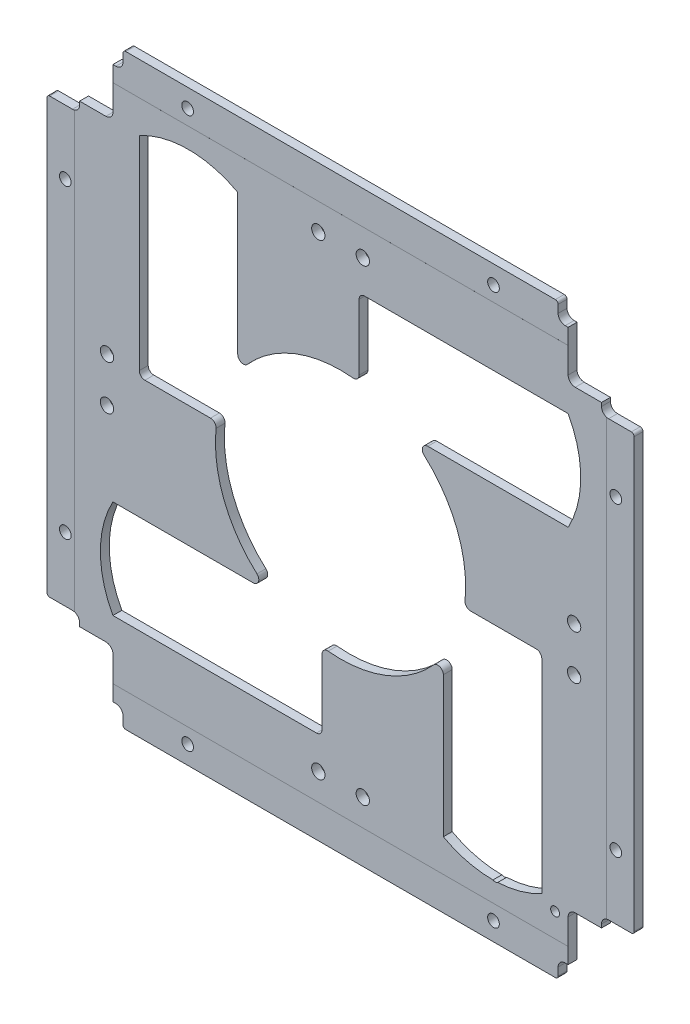
from build123d import *

# Parameters (mm, degrees)
SKETCH1_W                           = 106
SKETCH1_H                           = 106
MAINOUTLINE_DEPTH                   = 1.6
SKETCH4_W                           = 11.7
SKETCH4_H                           = 11.7
RAILCUTOUTS_DEPTH                   = 75.970394157
SKETCH13_W                          = 5.7
SKETCH13_H                          = 1.9
SKETCH13_W_2                        = 1.8
SKETCH13_H_2                        = 3
FILLETCUTOUTS_DEPTH                 = 75.970394157
SMOOTHCORNER_DEPTH                  = 10
MIRROR2_COPY_1_SKETCH_W             = 11.7
MIRROR2_COPY_1_SKETCH_H             = 11.7
MIRROR2_COPY_1_DEPTH                = 75.970394157
MIRROR2_COPY_2_SKETCH_W             = 5.7
MIRROR2_COPY_2_SKETCH_H             = 1.9
MIRROR2_COPY_2_SKETCH_W_2           = 1.8
MIRROR2_COPY_2_SKETCH_H_2           = 3
MIRROR2_COPY_2_DEPTH                = 75.970394157
MIRROR2_COPY_3_DEPTH                = 10
MIRROR2_COPY_4_SKETCH_W             = 11.7
MIRROR2_COPY_4_SKETCH_H             = 11.7
MIRROR2_COPY_4_DEPTH                = 75.970394157
MIRROR2_COPY_5_SKETCH_W             = 5.7
MIRROR2_COPY_5_SKETCH_H             = 1.9
MIRROR2_COPY_5_SKETCH_W_2           = 1.8
MIRROR2_COPY_5_SKETCH_H_2           = 3
MIRROR2_COPY_5_DEPTH                = 75.970394157
MIRROR2_COPY_6_DEPTH                = 10
M2_CLEARANCE_HOLE1_D                = 2.1
INTERBOARDCONNECTORHOLES_DEPTH      = 75.970394157
INTERBOARDCONNECTORHOLES_DEPTH_BACK = 75.970394157
SKETCH12_R                          = 0.8
SKETCH16_W                          = 90
SKETCH16_H                          = 6.2
SKETCH16_W_2                        = 5.2
SKETCH16_H_2                        = 90
CUT_EXTRUDE6_DEPTH                  = 0.001
CUT_EXTRUDE10_DEPTH                 = 75.970394157
CUT_EXTRUDE10_DEPTH_BACK            = 75.970394157
SKETCH21_R                          = 22.5
F_2U_TURNSTILE_CUTOUT_REACH         = 76.97
SKETCH24_OUTSIDE_W                  = 137.984
SKETCH24_OUTSIDE_H                  = 137.984
SKETCH24_OUTSIDE_W_2                = 105.6
SKETCH24_OUTSIDE_H_2                = 105.6
CUT_EXTRUDE19_DEPTH                 = 75.970394157
FILLET7_R                           = 0.5
FILLET8_R                           = 1
M2_CLEARANCE_HOLE2_D                = 2.4


with BuildPart() as part:
    # Sketch1 → mainOutline (new body)
    with BuildSketch(Plane.XY):
        Rectangle(SKETCH1_W, SKETCH1_H)
    extrude(amount=MAINOUTLINE_DEPTH)

    # Sketch4 → railCutouts (cut, through all)
    with BuildSketch(Plane(origin=(0, 0, 0), x_dir=(-1, 0, 0), z_dir=(0, 0, -1))):
        with Locations((47.15, 47.15)):
            Rectangle(SKETCH4_W, SKETCH4_H)
    railcutouts = extrude(amount=-RAILCUTOUTS_DEPTH, mode=Mode.SUBTRACT)

    # Sketch13 → filletCutouts (cut, symmetric)
    with BuildSketch(Plane(origin=(0, 0, 0), x_dir=(-1, 0, 0), z_dir=(0, 0, -1))):
        with Locations((50.15, 40.35)):
            Rectangle(SKETCH13_W, SKETCH13_H)
        with Locations((40.4, 51.5)):
            Rectangle(SKETCH13_W_2, SKETCH13_H_2)
    filletcutouts = extrude(amount=FILLETCUTOUTS_DEPTH, both=True, mode=Mode.SUBTRACT)

    # Sketch27 → smoothCorner (cut)
    with BuildSketch(Plane.XY.offset(1.6)):
        with BuildLine():
            Line((-40.928025612, 42.198025612), (-40.928025612, 49.628025612))
            Line((-40.928025612, 49.628025612), (-40.398025612, 49.628025612))
            ThreePointArc((-40.398025612, 49.628025612), (-39.5, 50), (-39.128025612, 50.898025612))
            Line((-39.128025612, 50.898025612), (-39.128025612, 53))
            Line((-39.128025612, 53), (-53, 53))
            Line((-53, 53), (-53, 39.028025612))
            Line((-53, 39.028025612), (-48.198025612, 39.028025612))
            ThreePointArc((-48.198025612, 39.028025612), (-47.3, 39.4), (-46.928025612, 40.298025612))
            Line((-46.928025612, 40.298025612), (-46.928025612, 40.928025612))
            Line((-46.928025612, 40.928025612), (-42.198025612, 40.928025612))
            ThreePointArc((-42.198025612, 40.928025612), (-41.3, 41.3), (-40.928025612, 42.198025612))
        make_face()
    smoothcorner = extrude(amount=-SMOOTHCORNER_DEPTH, mode=Mode.SUBTRACT)

    # Mirror1: railCutouts, filletCutouts, smoothCorner across plane
    add(railcutouts.mirror(Plane(origin=(0, 0, 0), x_dir=(0, 0, 1), z_dir=(1, 0, 0))), mode=Mode.SUBTRACT)
    add(filletcutouts.mirror(Plane(origin=(0, 0, 0), x_dir=(0, 0, 1), z_dir=(1, 0, 0))), mode=Mode.SUBTRACT)
    add(smoothcorner.mirror(Plane(origin=(0, 0, 0), x_dir=(0, 0, 1), z_dir=(1, 0, 0))), mode=Mode.SUBTRACT)

    # Mirror2 copy 1 sketch → Mirror2 copy 1 (cut, through all)
    with BuildSketch(Plane(origin=(0, 0, 0), x_dir=(1, 0, 0), z_dir=(0, 0, -1))):
        with Locations((47.15, 47.15)):
            Rectangle(MIRROR2_COPY_1_SKETCH_W, MIRROR2_COPY_1_SKETCH_H)
    extrude(amount=-MIRROR2_COPY_1_DEPTH, mode=Mode.SUBTRACT)

    # Mirror2 copy 2 sketch → Mirror2 copy 2 (cut, symmetric)
    with BuildSketch(Plane(origin=(0, 0, 0), x_dir=(1, 0, 0), z_dir=(0, 0, -1))):
        with Locations((50.15, 40.35)):
            Rectangle(MIRROR2_COPY_2_SKETCH_W, MIRROR2_COPY_2_SKETCH_H)
        with Locations((40.4, 51.5)):
            Rectangle(MIRROR2_COPY_2_SKETCH_W_2, MIRROR2_COPY_2_SKETCH_H_2)
    extrude(amount=MIRROR2_COPY_2_DEPTH, both=True, mode=Mode.SUBTRACT)

    # Mirror2 copy 3 sketch → Mirror2 copy 3 (cut)
    with BuildSketch(Plane(origin=(0, 0, 1.6), x_dir=(-1, 0, 0), z_dir=(0, 0, 1))):
        with BuildLine():
            Line((-40.928025612, 42.198025612), (-40.928025612, 49.628025612))
            Line((-40.928025612, 49.628025612), (-40.398025612, 49.628025612))
            ThreePointArc((-40.398025612, 49.628025612), (-39.5, 50), (-39.128025612, 50.898025612))
            Line((-39.128025612, 50.898025612), (-39.128025612, 53))
            Line((-39.128025612, 53), (-53, 53))
            Line((-53, 53), (-53, 39.028025612))
            Line((-53, 39.028025612), (-48.198025612, 39.028025612))
            ThreePointArc((-48.198025612, 39.028025612), (-47.3, 39.4), (-46.928025612, 40.298025612))
            Line((-46.928025612, 40.298025612), (-46.928025612, 40.928025612))
            Line((-46.928025612, 40.928025612), (-42.198025612, 40.928025612))
            ThreePointArc((-42.198025612, 40.928025612), (-41.3, 41.3), (-40.928025612, 42.198025612))
        make_face()
    extrude(amount=-MIRROR2_COPY_3_DEPTH, mode=Mode.SUBTRACT)

    # Mirror2 copy 4 sketch → Mirror2 copy 4 (cut, through all)
    with BuildSketch(Plane(origin=(0, 0, 0), x_dir=(-1, 0, 0), z_dir=(0, 0, -1))):
        with Locations((47.15, -47.15)):
            Rectangle(MIRROR2_COPY_4_SKETCH_W, MIRROR2_COPY_4_SKETCH_H)
    extrude(amount=-MIRROR2_COPY_4_DEPTH, mode=Mode.SUBTRACT)

    # Mirror2 copy 5 sketch → Mirror2 copy 5 (cut, symmetric)
    with BuildSketch(Plane(origin=(0, 0, 0), x_dir=(-1, 0, 0), z_dir=(0, 0, -1))):
        with Locations((50.15, -40.35)):
            Rectangle(MIRROR2_COPY_5_SKETCH_W, MIRROR2_COPY_5_SKETCH_H)
        with Locations((40.4, -51.5)):
            Rectangle(MIRROR2_COPY_5_SKETCH_W_2, MIRROR2_COPY_5_SKETCH_H_2)
    extrude(amount=MIRROR2_COPY_5_DEPTH, both=True, mode=Mode.SUBTRACT)

    # Mirror2 copy 6 sketch → Mirror2 copy 6 (cut)
    with BuildSketch(Plane.XY.offset(1.6)):
        with BuildLine():
            Line((-40.928025612, -42.198025612), (-40.928025612, -49.628025612))
            Line((-40.928025612, -49.628025612), (-40.398025612, -49.628025612))
            ThreePointArc((-40.398025612, -49.628025612), (-39.5, -50), (-39.128025612, -50.898025612))
            Line((-39.128025612, -50.898025612), (-39.128025612, -53))
            Line((-39.128025612, -53), (-53, -53))
            Line((-53, -53), (-53, -39.028025612))
            Line((-53, -39.028025612), (-48.198025612, -39.028025612))
            ThreePointArc((-48.198025612, -39.028025612), (-47.3, -39.4), (-46.928025612, -40.298025612))
            Line((-46.928025612, -40.298025612), (-46.928025612, -40.928025612))
            Line((-46.928025612, -40.928025612), (-42.198025612, -40.928025612))
            ThreePointArc((-42.198025612, -40.928025612), (-41.3, -41.3), (-40.928025612, -42.198025612))
        make_face()
    extrude(amount=-MIRROR2_COPY_6_DEPTH, mode=Mode.SUBTRACT)

    # M2 Clearance Hole1 (through all)
    with Locations(Plane(origin=(0, 0, 0), x_dir=(-1, 0, 0), z_dir=(0, 0, -1))):
        with Locations((49.5, -27.5), (27.5, -49.5), (-49.5, -27.5), (-27.5, -49.5), (-27.5, 49.5), (-49.5, 27.5), (27.5, 49.5), (49.5, 27.5)):
            Hole(M2_CLEARANCE_HOLE1_D / 2)

    # Sketch12 → interboardConnectorHoles (cut, two sides: drawn at the far end of the back side and taken through both)
    with BuildSketch(Plane.XY.offset(1.6).offset(-INTERBOARDCONNECTORHOLES_DEPTH_BACK)):
        with Locations((27.815, -42.5)):
            Circle(SKETCH12_R)
        with Locations((38.585, -42.5)):
            Circle(SKETCH12_R)
    extrude(amount=INTERBOARDCONNECTORHOLES_DEPTH + INTERBOARDCONNECTORHOLES_DEPTH_BACK, mode=Mode.SUBTRACT)

    # Sketch16 → Cut-Extrude6 (cut)
    with BuildSketch(Plane.XY.offset(1.6)):
        with Locations((0, -49.9)):
            Rectangle(SKETCH16_W, SKETCH16_H)
        with Locations((0, 49.9)):
            Rectangle(SKETCH16_W, SKETCH16_H)
        with Locations((-50.4, 0)):
            Rectangle(SKETCH16_W_2, SKETCH16_H_2)
        with Locations((50.4, 0)):
            Rectangle(SKETCH16_W_2, SKETCH16_H_2)
    extrude(amount=-CUT_EXTRUDE6_DEPTH, mode=Mode.SUBTRACT)

    # Sketch21 → Cut-Extrude10 (cut, two sides: drawn at the far end of the back side and taken through both)
    with BuildSketch(Plane.XY.offset(-CUT_EXTRUDE10_DEPTH_BACK)):
        Circle(SKETCH21_R)
    extrude(amount=CUT_EXTRUDE10_DEPTH + CUT_EXTRUDE10_DEPTH_BACK, mode=Mode.SUBTRACT)

    # Sketch25 → 2U turnstile cutout (cut, up to next)
    with BuildSketch(Plane(origin=(0, 0, 0), x_dir=(-1, 0, 0), z_dir=(0, 0, -1)), mode=Mode.PRIVATE) as f_2u_turnstile_cutout_sk1:
        with BuildLine():
            Line((40.937273383, -36.1866), (3.332, -36.1866))
            Line((3.332, -36.1866), (3.332, -18.4866))
            Line((3.332, -18.4866), (40.937273383, -18.4866))
            ThreePointArc((40.937273383, -18.4866), (43.19142776, -27.3366), (40.937273383, -36.1866))
        make_face()
    f_2u_turnstile_cutout_tool1 = extrude(f_2u_turnstile_cutout_sk1.sketch, amount=-F_2U_TURNSTILE_CUTOUT_REACH, mode=Mode.PRIVATE) & part.part
    # Sketch25 → 2U turnstile cutout (cut, up to next)
    with BuildSketch(Plane(origin=(0, 0, 0), x_dir=(-1, 0, 0), z_dir=(0, 0, -1)), mode=Mode.PRIVATE) as f_2u_turnstile_cutout_sk2:
        with BuildLine():
            Line((-18.4866, -3.332), (-18.4866, -40.937273383))
            ThreePointArc((-18.4866, -40.937273383), (-27.3366, -43.19142776), (-36.1866, -40.937273383))
            Line((-36.1866, -40.937273383), (-36.1866, -3.332))
            Line((-36.1866, -3.332), (-18.4866, -3.332))
        make_face()
    f_2u_turnstile_cutout_tool2 = extrude(f_2u_turnstile_cutout_sk2.sketch, amount=-F_2U_TURNSTILE_CUTOUT_REACH, mode=Mode.PRIVATE) & part.part
    # Sketch25 → 2U turnstile cutout (cut, up to next)
    with BuildSketch(Plane(origin=(0, 0, 0), x_dir=(-1, 0, 0), z_dir=(0, 0, -1)), mode=Mode.PRIVATE) as f_2u_turnstile_cutout_sk3:
        with BuildLine():
            Line((-3.332, 18.4866), (-40.937273383, 18.4866))
            ThreePointArc((-40.937273383, 18.4866), (-43.19142776, 27.3366), (-40.937273383, 36.1866))
            Line((-40.937273383, 36.1866), (-3.332, 36.1866))
            Line((-3.332, 36.1866), (-3.332, 18.4866))
        make_face()
    f_2u_turnstile_cutout_tool3 = extrude(f_2u_turnstile_cutout_sk3.sketch, amount=-F_2U_TURNSTILE_CUTOUT_REACH, mode=Mode.PRIVATE) & part.part
    # Sketch25 → 2U turnstile cutout (cut, up to next)
    with BuildSketch(Plane(origin=(0, 0, 0), x_dir=(-1, 0, 0), z_dir=(0, 0, -1)), mode=Mode.PRIVATE) as f_2u_turnstile_cutout_sk4:
        with BuildLine():
            Line((18.4866, 3.332), (18.4866, 40.937273383))
            ThreePointArc((18.4866, 40.937273383), (27.3366, 43.19142776), (36.1866, 40.937273383))
            Line((36.1866, 40.937273383), (36.1866, 3.332))
            Line((36.1866, 3.332), (18.4866, 3.332))
        make_face()
    f_2u_turnstile_cutout_tool4 = extrude(f_2u_turnstile_cutout_sk4.sketch, amount=-F_2U_TURNSTILE_CUTOUT_REACH, mode=Mode.PRIVATE) & part.part
    add(f_2u_turnstile_cutout_tool1.solids().sort_by_distance((-22.901342, -27.3366, 0))[0], mode=Mode.SUBTRACT)
    add(f_2u_turnstile_cutout_tool2.solids().sort_by_distance((27.3366, -22.901342, 0))[0], mode=Mode.SUBTRACT)
    add(f_2u_turnstile_cutout_tool3.solids().sort_by_distance((22.901342, 27.3366, 0))[0], mode=Mode.SUBTRACT)
    add(f_2u_turnstile_cutout_tool4.solids().sort_by_distance((-27.3366, 22.901342, 0))[0], mode=Mode.SUBTRACT)

    # Sketch24 outside → Cut-Extrude19 (cut, through all)
    with BuildSketch(Plane.XY.offset(1.6)):
        Rectangle(SKETCH24_OUTSIDE_W, SKETCH24_OUTSIDE_H)
        Rectangle(SKETCH24_OUTSIDE_W_2, SKETCH24_OUTSIDE_H_2, mode=Mode.SUBTRACT)
    extrude(amount=-CUT_EXTRUDE19_DEPTH, mode=Mode.SUBTRACT)

    # Fillet7
    fillet7_edges = [part.edges().sort_by_distance(p)[0] for p in [
        (-52.8, -39.028025612, 0.7995),
        (-39.128025612, -52.8, 0.7995),
        (39.128025612, -52.8, 0.7995),
        (52.8, -39.028025612, 0.7995),
        (52.8, 39.028025612, 0.7995),
        (39.128025612, 52.8, 0.7995),
        (-39.128025612, 52.8, 0.7995),
        (-52.8, 39.028025612, 0.7995),
    ]]
    fillet(fillet7_edges, radius=FILLET7_R)

    # Fillet8
    fillet8_edges = [part.edges().sort_by_distance(p)[0] for p in [
        (-3.332, -36.1866, 0.8),
        (-18.4866, 12.825584604, 0.8),
        (-36.1866, 3.332, 0.8),
        (-22.251916232, 3.332, 0.8),
        (-12.825584604, -18.4866, 0.8),
        (-3.332, -22.251916232, 0.8),
        (18.4866, -12.825584604, 0.8),
        (36.1866, -3.332, 0.8),
        (22.251916232, -3.332, 0.8),
        (12.825584604, 18.4866, 0.8),
        (3.332, 22.251916232, 0.8),
        (3.332, 36.1866, 0.8),
    ]]
    fillet(fillet8_edges, radius=FILLET8_R)

    # M2 Clearance Hole2 (through all)
    with Locations(Plane(origin=(42, -4, 0), x_dir=(-1, 0, 0), z_dir=(0, 0, -1))):
        with Locations((0, 0), (0, 8), (46, 46), (38, 46), (84, 8), (84, 0), (38, -38), (46, -38)):
            Hole(M2_CLEARANCE_HOLE2_D / 2)


solid = part.part
